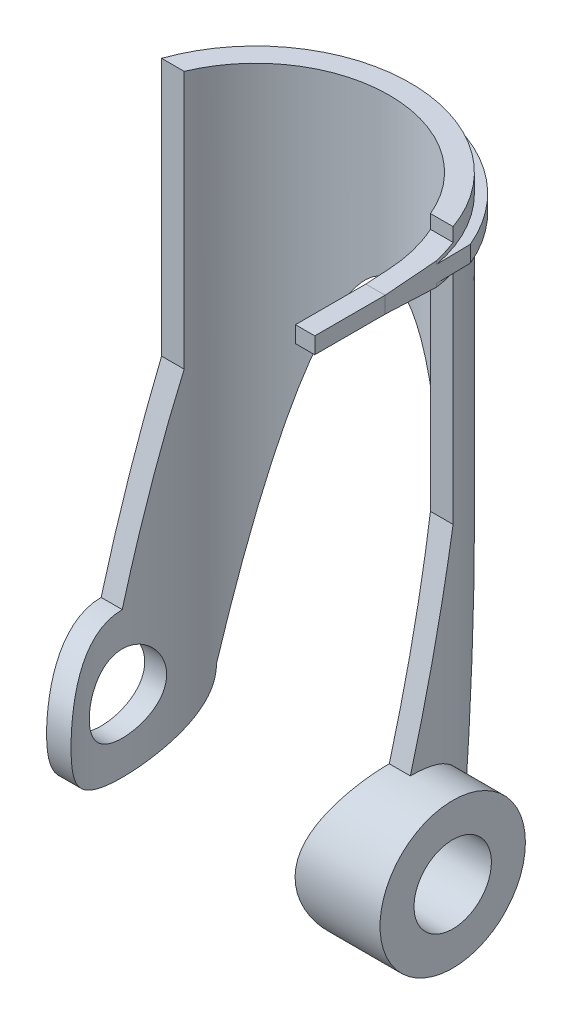
from build123d import *

# Parameters (mm, degrees)
SKETCH1_R               = 16.485
SKETCH1_R_2             = 14.235
BOSS_EXTRUDE1_DEPTH     = 63
SKETCH2_R               = 4.125
CUT_EXTRUDE1_DEPTH      = 73.991616813
CUT_EXTRUDE2_START      = -32.970000348
CUT_EXTRUDE2_DEPTH      = 32.970000348
CUT_EXTRUDE4_DEPTH      = 68.175222223
CUT_EXTRUDE4_DEPTH_BACK = 15
BOSS_EXTRUDE2_DEPTH     = 0.875
SKETCH9_W               = 2.280579787
SKETCH9_H               = 1.75
BOSS_EXTRUDE4_DEPTH     = 7.5
SKETCH10_W              = 0.221248718
SKETCH10_H              = 10
CUT_EXTRUDE5_DEPTH      = 2.5
BOSS_EXTRUDE5_REACH     = 77.139
SKETCH11_R              = 7.75
SKETCH11_R_2            = 4.125
CUT_EXTRUDE7_DEPTH      = 10


# Read off the part's stored shape, not the designer's step: Cut-Extrude2
with BuildPart() as part:
    # Sketch1 → Boss-Extrude1 (new body)
    with BuildSketch(Plane(origin=(0, 0, 0), x_dir=(1, 0, 0), z_dir=(0, 1, 0))):
        with Locations(Location((0, 0, 0), (0, 0, 270))):
            Circle(SKETCH1_R)
        with Locations(Location((0, 0, 0), (0, 0, 270))):
            Circle(SKETCH1_R_2, mode=Mode.SUBTRACT)
    extrude(amount=BOSS_EXTRUDE1_DEPTH)

    # Sketch2 → Cut-Extrude1 (cut, through all)
    with BuildSketch(Plane(origin=(16.485, 0, 0), x_dir=(0, 0, -1), z_dir=(1, 0, 0))):
        with Locations((0, 7.75)):
            Circle(SKETCH2_R)
    extrude(amount=-CUT_EXTRUDE1_DEPTH, mode=Mode.SUBTRACT)

    # Cut-Extrude2 outline → Cut-Extrude2 (cut)
    with BuildSketch(Plane(origin=(16.485, 0, 0), x_dir=(0, 0, -1), z_dir=(1, 0, 0)).offset(CUT_EXTRUDE2_START)):
        Polygon((5.5, 63), (-16.485, 63), (-16.485, 61.04), (-2.5, 61.04), (5.5, 61.54), align=None)
        with BuildLine():
            Line((-2.5, 59.29), (-16.485, 59.29))
            Line((-16.485, 59.29), (-16.485, 0))
            Line((-16.485, 0), (1.7e-08, 0))
            ThreePointArc((1.7e-08, 0), (-7.75, 7.749999991), (0, 15.5))
            Line((0, 15.5), (5.5, 35.5))
            Line((5.5, 35.5), (5.5, 58.79))
            Line((5.5, 58.79), (-2.5, 59.29))
        make_face()
        with BuildLine():
            ThreePointArc((7.75, 7.75), (5.48007756, 2.269922452), (1.7e-08, 0))
            Line((1.7e-08, 0), (16.485, 0))
            Line((16.485, 0), (16.485, 59.29))
            Line((16.485, 59.29), (7.75, 7.75))
        make_face()
    extrude(amount=CUT_EXTRUDE2_DEPTH, mode=Mode.SUBTRACT)

    # Sketch6 → Cut-Extrude4 (cut, two sides: drawn at the far end of the back side and taken through both)
    with BuildSketch(Plane(origin=(0, 63, 0), x_dir=(1, 0, 0), z_dir=(0, 1, 0)).offset(-CUT_EXTRUDE4_DEPTH_BACK)):
        Polygon((-103.23133718, 5.5), (-15.540438379, 5.5), (-13.1295554, 5.5), (0, 0), (14.013751282, -2.5), (16.294331069, -2.5), (103.985229871, -2.5), (97.219313689, -177.751240534), (-109.997253363, -169.751240534), align=None)
    extrude(amount=CUT_EXTRUDE4_DEPTH + CUT_EXTRUDE4_DEPTH_BACK, mode=Mode.SUBTRACT)

    # Sketch7 → Boss-Extrude2 (add, symmetric)
    with BuildSketch(Plane(origin=(0, 60.165, 0), x_dir=(1, 0, 0), z_dir=(0, 1, 0))):
        with BuildLine():
            ThreePointArc((0.300302569, 16.48226451), (10.624070386, 12.604933694), (16.193433276, 3.086736743))
            Line((16.193433276, 3.086736743), (16.127170788, 6.755707763))
            ThreePointArc((16.127170788, 6.755707763), (12.065849771, 12.654662947), (5.980222206, 16.430525474))
            Line((5.980222206, 16.430525474), (0.300302569, 16.48226451))
        make_face()
    extrude(amount=BOSS_EXTRUDE2_DEPTH, both=True)

    # Sketch9 → Boss-Extrude4 (add)
    with BuildSketch(Plane.XY.offset(2.5)):
        with Locations((15.154041176, 60.165)):
            Rectangle(SKETCH9_W, SKETCH9_H)
    extrude(amount=BOSS_EXTRUDE4_DEPTH)

    # Sketch10 → Cut-Extrude5 (cut, symmetric)
    with BuildSketch(Plane(origin=(0, 61.04, 0), x_dir=(1, 0, 0), z_dir=(0, 1, 0))):
        with Locations((14.124375641, -5)):
            Rectangle(SKETCH10_W, SKETCH10_H)
    extrude(amount=CUT_EXTRUDE5_DEPTH, both=True, mode=Mode.SUBTRACT)

    # Sketch11 → Boss-Extrude5 (add, up to next)
    with BuildSketch(Plane(origin=(21, 0, 0), x_dir=(0, 0, -1), z_dir=(1, 0, 0)), mode=Mode.PRIVATE) as boss_extrude5_sk1:
        with Locations((0, 7.75)):
            Circle(SKETCH11_R)
        with Locations((0, 7.75)):
            Circle(SKETCH11_R_2, mode=Mode.SUBTRACT)
    boss_extrude5_tool1 = extrude(boss_extrude5_sk1.sketch, amount=-BOSS_EXTRUDE5_REACH, mode=Mode.PRIVATE) - part.part
    add(boss_extrude5_tool1.solids().sort_by_distance((21, 7.75, 7.530797))[0])

    # Sketch16 → Cut-Extrude7 (cut)
    with BuildSketch(Plane(origin=(0, 63, 0), x_dir=(1, 0, 0), z_dir=(0, 1, 0))):
        Polygon((16.127170788, 6.755707763), (16.294331069, -2.5), (18.305732321, -2.5), (18.305732321, 6.795053101), align=None)
    extrude(amount=-CUT_EXTRUDE7_DEPTH, mode=Mode.SUBTRACT)


solid = part.part
